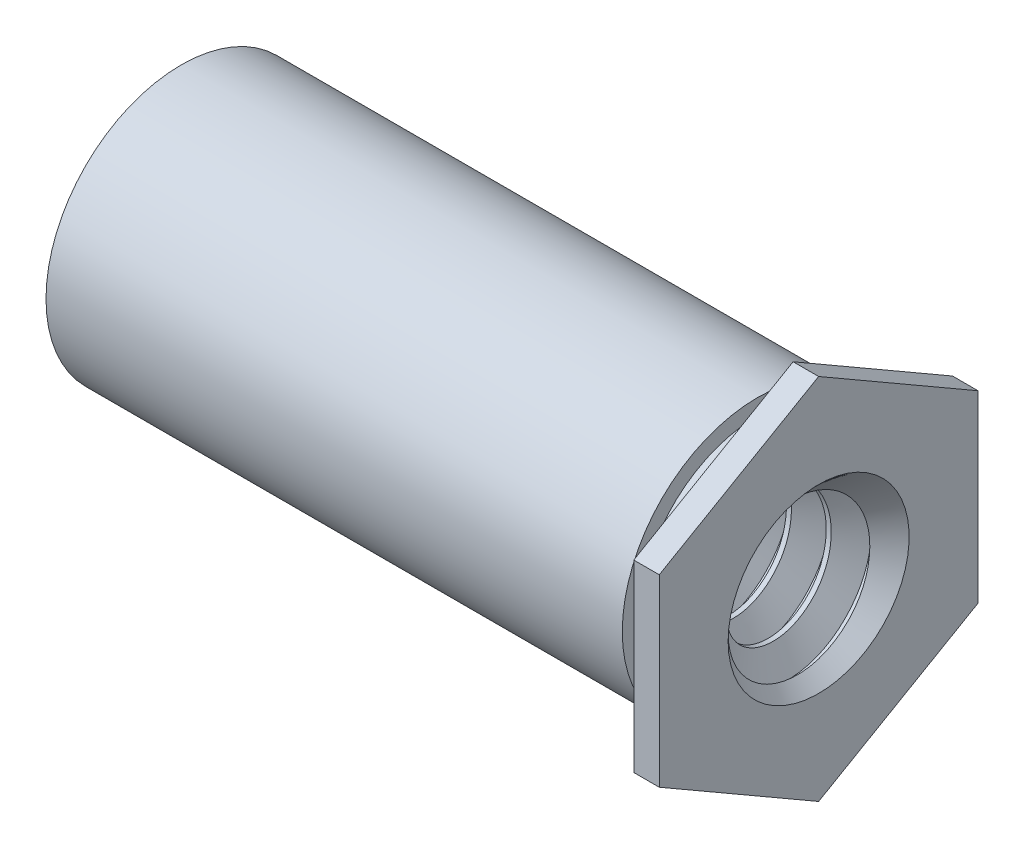
from build123d import *

# Parameters (mm, degrees)
SKETCH2_R                = 2.6924
SKETCH2_R_2              = 1.7526
EXTRUDE1_DEPTH           = 12.7
EXTRUDE2_START           = -0.508
SKETCH3_R                = 1.7526
EXTRUDE2_DEPTH           = 0.508
EXTRUDE3_START           = 0.7112
SKETCH4_R                = 2.6924
SKETCH4_R_2              = 2.3749
EXTRUDE3_DEPTH           = 0.7112
SWEEP1_PITCH             = 0.79375
SKETCH8_R                = 1.8034
EXTRUDE6_DEPTH           = 15.339017605
SKETCH9_R                = 1.8034
EXTRUDE7_OTHER_WAY_DEPTH = 14.594537906
SKETCH10_R               = 1.8034
SKETCH10_R_2             = 1.196952892
EXTRUDE8_DEPTH           = 4.7625


with BuildPart() as part:
    # Sketch2 → Extrude1 (new body)
    with BuildSketch(Plane(origin=(-6.35, 0, 0), x_dir=(0, 0, -1), z_dir=(1, 0, 0))):
        Circle(SKETCH2_R)
        Circle(SKETCH2_R_2, mode=Mode.SUBTRACT)
    extrude(amount=EXTRUDE1_DEPTH)

    # Sketch3 → Extrude2 (add)
    with BuildSketch(Plane(origin=(6.35, 0, 0), x_dir=(0, 0, -1), z_dir=(1, 0, 0)).offset(EXTRUDE2_START)):
        Polygon((0, 3.666174209), (-3.175, 1.833087105), (-3.175, -1.833087105), (0, -3.666174209), (3.175, -1.833087105), (3.175, 1.833087105), align=None)
        Circle(SKETCH3_R, mode=Mode.SUBTRACT)
    extrude(amount=EXTRUDE2_DEPTH)

    # Sketch4 → Extrude3 (cut)
    with BuildSketch(Plane.ZY.offset(-5.842).offset(EXTRUDE3_START)):
        Circle(SKETCH4_R)
        Circle(SKETCH4_R_2, mode=Mode.SUBTRACT)
    extrude(amount=-EXTRUDE3_DEPTH, mode=Mode.SUBTRACT)

    # Sweep1: arcs per turn and ends read off the stored shape
    # Sweep1: the profile of Sketch7 profile screwed along a left-hand helix through 17 turns, 8 arcs to a turn; built about Z, then put on its axis
    sweep1_z = Axis((0, 0, 0), (0, 0, 1))
    sweep1_corners = [(1.7529, 0, 0.000173205), (1.7529, 0, -0.694704455), (1.237044252, 0, -0.396875), (1.237044252, 0, -0.29765625)]
    with BuildLine(mode=Mode.PRIVATE) as sweep1_profile:
        Line(sweep1_corners[0], sweep1_corners[1])
        Line(sweep1_corners[1], sweep1_corners[2])
        Line(sweep1_corners[2], sweep1_corners[3])
        Line(sweep1_corners[3], sweep1_corners[0])
    sweep1_cap = Face(sweep1_profile.wire())
    sweep1_turn_angles = [0, -22.5, -45, -67.5, -90, -112.5, -135, -157.5, -180, -202.5, -225, -247.5, -270, -292.5, -315, -337.5, -360]
    sweep1_turn_weights = [1, 0.9238795325112867, 1, 0.9238795325112867, 1, 0.9238795325112867, 1, 0.9238795325112867, 1, 0.9238795325112867, 1, 0.9238795325112867, 1, 0.9238795325112867, 1, 0.9238795325112867, 1]
    sweep1_turn_rails = [Edge.make_bspline([Vector(p[0], p[1], 0).rotate(sweep1_z, sweep1_turn_angles[k]) / sweep1_turn_weights[k] + Vector(0, 0, p[2] + -SWEEP1_PITCH * sweep1_turn_angles[k] / 360) for k in range(17)], [0, 0, 0, 1, 1, 2, 2, 3, 3, 4, 4, 5, 5, 6, 6, 7, 7, 8, 8, 8], 2, sweep1_turn_weights) for p in sweep1_corners]
    sweep1_turn_sides = [Face.make_surface_from_curves(sweep1_turn_rails[p[0]], sweep1_turn_rails[p[1]]) for p in [(0, 1), (1, 2), (2, 3), (3, 0)]]
    sweep1 = Plane(origin=(6.35, 0, 0), x_dir=(0, 1, 0), z_dir=(-1, 0, 0)) * Solid(Shell([*[p.moved(Location((0, 0, SWEEP1_PITCH * i))) for i in range(17) for p in sweep1_turn_sides], sweep1_cap, sweep1_cap.rotate(sweep1_z, -6120).moved(Location((0, 0, -SWEEP1_PITCH * -6120 / 360)))]))
    add(sweep1)

    # Sketch8 → Extrude6 (cut)
    with BuildSketch(Plane.ZY.offset(-6.35)):
        Circle(SKETCH8_R)
    extrude(amount=-EXTRUDE6_DEPTH, mode=Mode.SUBTRACT)

    # Extrude6 cone 1 section (through the dimple's axis) → Extrude6 other way (revolve, cut)
    with BuildSketch(Plane(origin=(6.35, 0, 0), x_dir=(0, 0, -1), z_dir=(0, 1, 0))):
        Polygon((0, 0), (1.8034, 0), (0, 1.8034), align=None)
    revolve(axis=Axis((6.35, 0, 0), (-1, 0, 0)), mode=Mode.SUBTRACT)

    # Extrude7 cone 1 section (through the dimple's axis) → Extrude7 (revolve, cut)
    with BuildSketch(Plane(origin=(-6.35, 0, 0), x_dir=(0, 0, 1), z_dir=(0, 1, 0))):
        Polygon((0, 0), (1.8034, 0), (0, 1.8034), align=None)
    revolve(axis=Axis((-6.35, 0, 0), (1, 0, 0)), mode=Mode.SUBTRACT)

    # Sketch9 → Extrude7 other way (cut)
    with BuildSketch(Plane(origin=(-6.35, 0, 0), x_dir=(0, 0, -1), z_dir=(1, 0, 0))):
        Circle(SKETCH9_R)
    extrude(amount=-EXTRUDE7_OTHER_WAY_DEPTH, mode=Mode.SUBTRACT)

    # Sketch10 → Extrude8 (add)
    with BuildSketch(Plane(origin=(-6.35, 0, 0), x_dir=(0, 0, -1), z_dir=(1, 0, 0))):
        Circle(SKETCH10_R)
        Circle(SKETCH10_R_2, mode=Mode.SUBTRACT)
    extrude(amount=EXTRUDE8_DEPTH)


solid = part.part
